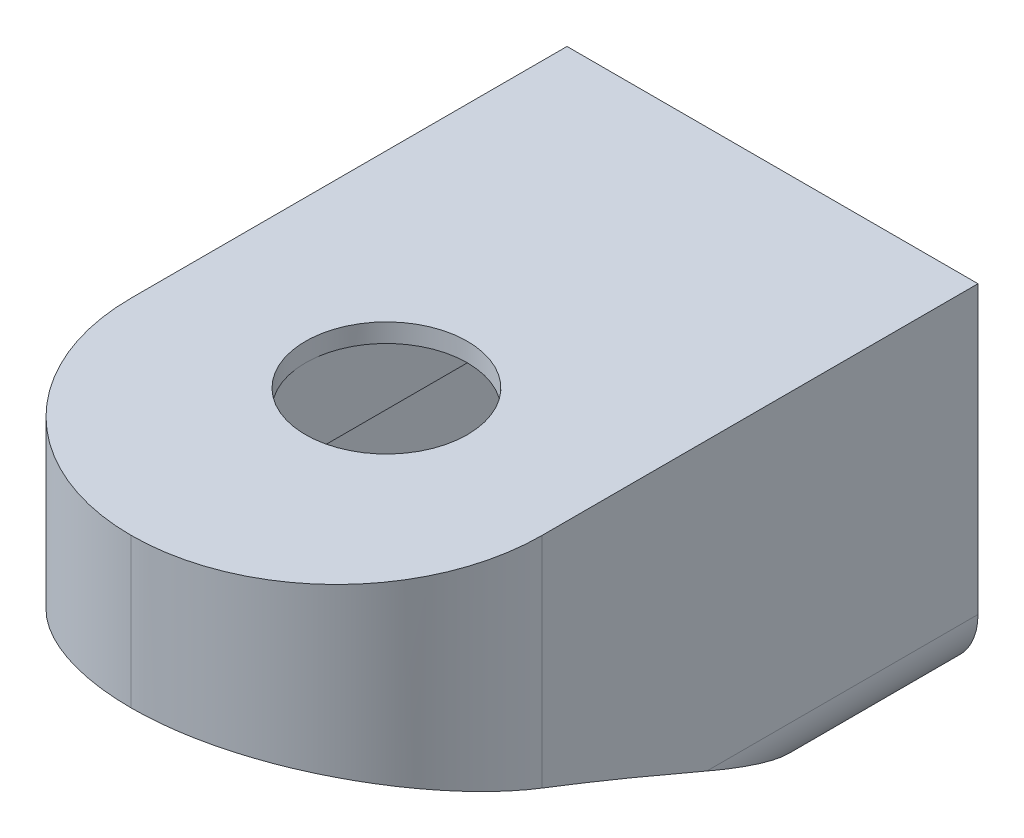
from build123d import *

# Parameters (mm, degrees)
SKETCH1_W               = 33
SKETCH1_H               = 28
BOSS_EXTRUDE1_DEPTH     = 46
CUT_EXTRUDE1_DEPTH      = 59.318093247
CUT_EXTRUDE1_DEPTH_BACK = 59.318093247
CUT_EXTRUDE2_START      = -3
CUT_EXTRUDE2_DEPTH      = 27
FILLET1_R               = 12.5
FILLET2_R               = 16.5
FILLET3_R               = 5
SKETCH4_W               = 13
SKETCH4_H               = 23
CUT_EXTRUDE3_DEPTH      = 9
SKETCH5_R               = 6.5
CUT_EXTRUDE4_DEPTH      = 56.592265809
SKETCH6_R               = 1
CUT_EXTRUDE5_DEPTH      = 8
BOSS_EXTRUDE2_DEPTH     = 5.5
SKETCH11_R              = 13.5
CUT_EXTRUDE8_DEPTH      = 7.5
SKETCH7_R               = 1.3
SKETCH7_R_2             = 2.6
CUT_EXTRUDE6_DEPTH      = 0.5
SKETCH12_R              = 1
CUT_EXTRUDE9_DEPTH      = 2.5


with BuildPart() as part:
    # Sketch1 → Boss-Extrude1 (new body)
    with BuildSketch(Plane.XY):
        Rectangle(SKETCH1_W, SKETCH1_H)
    extrude(amount=BOSS_EXTRUDE1_DEPTH)

    # Sketch2 → Cut-Extrude1 (cut, two sides: drawn at the far end of the back side and taken through both)
    with BuildSketch(Plane(origin=(16.5, 0, 0), x_dir=(0, 0, -1), z_dir=(1, 0, 0)).offset(-CUT_EXTRUDE1_DEPTH_BACK)):
        with BuildLine():
            Line((-46, -14), (-5, -14))
            add(Edge.make_bspline(
                [(-5, -14), (-31.642917286, -1.866068932), (-46, 2)],
                knots=[0, 0, 0, 1, 1, 1], degree=2))
            Line((-46, 2), (-46, -14))
        make_face()
    extrude(amount=CUT_EXTRUDE1_DEPTH + CUT_EXTRUDE1_DEPTH_BACK, mode=Mode.SUBTRACT)

    # Sketch3 → Cut-Extrude2 (cut)
    with BuildSketch(Plane(origin=(16.5, 0, 0), x_dir=(0, 0, -1), z_dir=(1, 0, 0)).offset(CUT_EXTRUDE2_START)):
        with BuildLine():
            Line((-5, -14), (-2.5, -14))
            Line((-2.5, -14), (-2.5, 3.5))
            Line((-2.5, 3.5), (-40.5, 3.5))
            Line((-40.5, 3.5), (-40.5, 0.361845))
            add(Edge.make_bspline(
                [(-5, -14), (-26.900788686, -4.025767171), (-40.5, 0.361845)],
                knots=[0, 0, 0, 1, 1, 1], degree=2))
        make_face()
    extrude(amount=-CUT_EXTRUDE2_DEPTH, mode=Mode.SUBTRACT)

    # Fillet1
    fillet1_edges = [part.edges().sort_by_distance(p)[0] for p in [
        (13.5, 1.9309225, 40.5),
        (-13.5, 1.9309225, 40.5),
    ]]
    fillet(fillet1_edges, radius=FILLET1_R)

    # Fillet2
    fillet2_edges = [part.edges().sort_by_distance(p)[0] for p in [
        (16.5, 8, 46),
        (-16.5, 8, 46),
    ]]
    fillet(fillet2_edges, radius=FILLET2_R - 0.0001)  # a hair under: the kernel refuses the full size

    # Fillet3
    fillet3_edges = [part.edges().sort_by_distance(p)[0] for p in [
        (16.5, -14, 2.5),
        (-16.5, -14, 2.5),
    ]]
    fillet(fillet3_edges, radius=FILLET3_R)

    # Sketch4 → Cut-Extrude3 (cut)
    with BuildSketch(Plane.XZ.offset(-3.5)):
        with Locations((0, 20.5)):
            Rectangle(SKETCH4_W, SKETCH4_H)
    extrude(amount=-CUT_EXTRUDE3_DEPTH, mode=Mode.SUBTRACT)

    # Sketch5 → Cut-Extrude4 (cut, through all)
    with BuildSketch(Plane.XZ.offset(-12.5)):
        with Locations((0, 25.5)):
            Circle(SKETCH5_R)
    extrude(amount=-CUT_EXTRUDE4_DEPTH, mode=Mode.SUBTRACT)

    # Sketch6 → Cut-Extrude5 (cut)
    with BuildSketch(Plane.XZ.offset(-3.5)):
        with Locations((0, 34.3)):
            Circle(SKETCH6_R)
        with Locations((0, 6.7)):
            Circle(SKETCH6_R)
    extrude(amount=-CUT_EXTRUDE5_DEPTH, mode=Mode.SUBTRACT)

    # Sketch10 → Boss-Extrude2 (add)
    with BuildSketch(Plane(origin=(0, 0, 0), x_dir=(-1, 0, 0), z_dir=(0, 0, -1))):
        with BuildLine():
            Line((-16.5, 14), (-16.5, -9))
            ThreePointArc((-16.5, -9), (-15.035533906, -12.535533906), (-11.5, -14))
            Line((-11.5, -14), (11.5, -14))
            ThreePointArc((11.5, -14), (15.035533906, -12.535533906), (16.5, -9))
            Line((16.5, -9), (16.5, 14))
            Line((16.5, 14), (-16.5, 14))
        make_face()
    extrude(amount=BOSS_EXTRUDE2_DEPTH)

    # Sketch11 → Cut-Extrude8 (cut)
    with BuildSketch(Plane(origin=(0, 0, -5.5), x_dir=(-1, 0, 0), z_dir=(0, 0, -1))):
        with Locations((1, -0.016150077)):
            Circle(SKETCH11_R)
    extrude(amount=-CUT_EXTRUDE8_DEPTH, mode=Mode.SUBTRACT)

    # Sketch7 → Cut-Extrude6 (cut)
    with BuildSketch(Plane(origin=(0, 0, 2), x_dir=(-1, 0, 0), z_dir=(0, 0, -1))):
        with Locations((5.25, 0)):
            Circle(SKETCH7_R)
        with Locations((-4.75, 0)):
            Circle(SKETCH7_R_2)
        with Locations((0.25, 0)):
            Circle(SKETCH7_R)
    extrude(amount=-CUT_EXTRUDE6_DEPTH, mode=Mode.SUBTRACT)

    # Sketch12 → Cut-Extrude9 (cut)
    with BuildSketch(Plane.XZ.offset(-3.5)):
        with BuildLine():
            Line((-13.5, 2.5), (13.5, 2.5))
            Line((13.5, 2.5), (13.5, 28))
            ThreePointArc((13.5, 28), (9.838834765, 36.838834765), (1, 40.5))
            Line((1, 40.5), (-1, 40.5))
            ThreePointArc((-1, 40.5), (-9.838834765, 36.838834765), (-13.5, 28))
            Line((-13.5, 28), (-13.5, 2.5))
        make_face()
        with Locations((0, 6.7)):
            Circle(SKETCH12_R, mode=Mode.SUBTRACT)
        Polygon((6.5, 9), (-6.5, 9), (-6.5, 32), (0, 32), (6.5, 32), align=None, mode=Mode.SUBTRACT)
        with Locations((0, 34.3)):
            Circle(SKETCH12_R, mode=Mode.SUBTRACT)
    extrude(amount=-CUT_EXTRUDE9_DEPTH, mode=Mode.SUBTRACT)


solid = part.part
